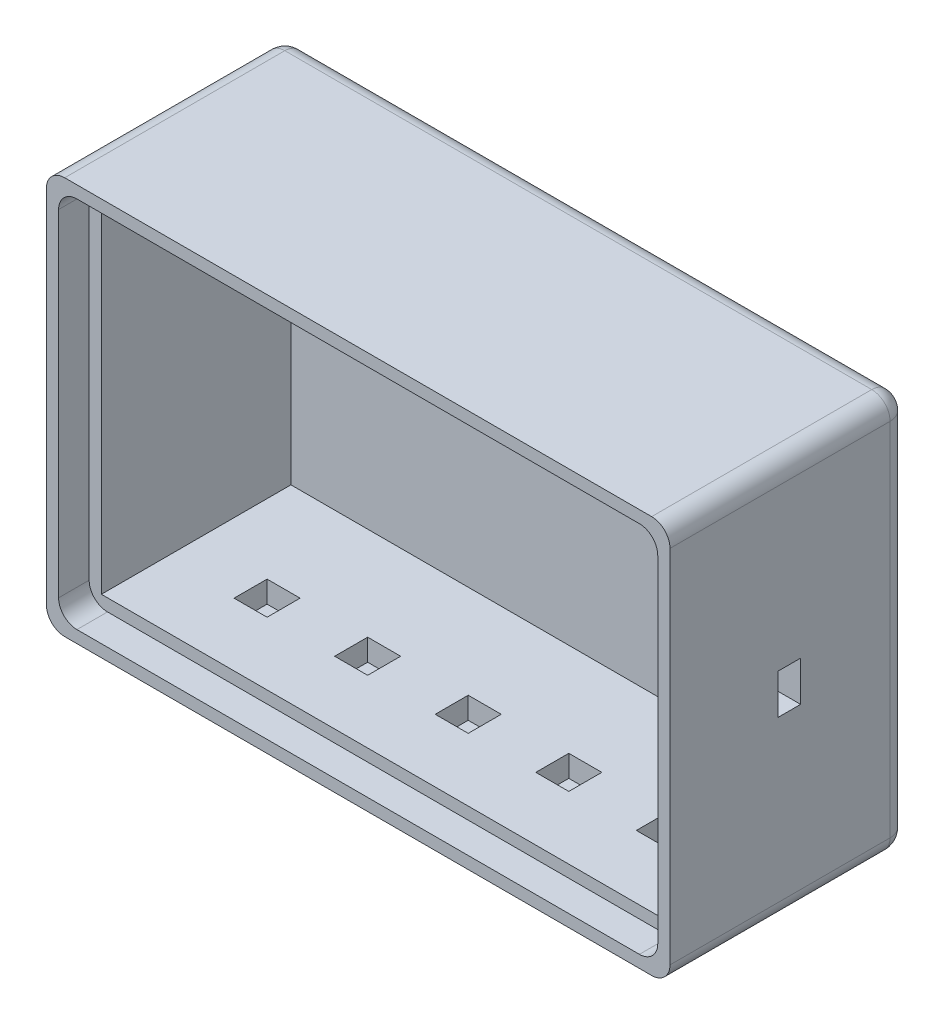
from build123d import *

# Parameters (mm, degrees)
SKICA1_W                 = 102
SKICA1_H                 = 65
P_IDAT_VYSUNUT_M1_DEPTH  = 3
SKICA1_4_W               = 102
SKICA1_4_H               = 65
SKICA1_4_W_2             = 98
SKICA1_4_H_2             = 61
P_IDAT_VYSUNUT_M2_DEPTH  = 39
SKICA1_5_W               = 98
SKICA1_5_H               = 61
SKICA1_5_W_2             = 94
SKICA1_5_H_2             = 57
P_IDAT_VYSUNUT_M3_DEPTH  = 34
SKICA2_W                 = 3.73
SKICA2_H                 = 6.55
ODEBRAT_VYSUNUT_M1_DEPTH = 4
ZAOBLIT1_R               = 3
ZAOBLIT2_R               = 3
ODEBRAT_START            = -0.45
SKICA4_W                 = 5.4
SKICA4_H                 = 5.4
ODEBRAT_VYSUNUT_M2_DEPTH = 3.55
ZAOBLIT3_R               = 3


with BuildPart() as part:
    # Skica1 → Přidat vysunutím1 (new body)
    with BuildSketch(Plane.XY):
        with Locations((49, 30.5)):
            Rectangle(SKICA1_W, SKICA1_H)
    extrude(amount=P_IDAT_VYSUNUT_M1_DEPTH)

    # Skica1<4> → Přidat vysunutím2 (add)
    with BuildSketch(Plane.XY):
        with Locations((49, 30.5)):
            Rectangle(SKICA1_4_W, SKICA1_4_H)
        with Locations((49, 30.5)):
            Rectangle(SKICA1_4_W_2, SKICA1_4_H_2, mode=Mode.SUBTRACT)
    extrude(amount=P_IDAT_VYSUNUT_M2_DEPTH)

    # Skica1<5> → Přidat vysunutím3 (add)
    with BuildSketch(Plane.XY):
        with Locations((49, 30.5)):
            Rectangle(SKICA1_5_W, SKICA1_5_H)
        with Locations((49, 30.5)):
            Rectangle(SKICA1_5_W_2, SKICA1_5_H_2, mode=Mode.SUBTRACT)
    extrude(amount=P_IDAT_VYSUNUT_M3_DEPTH)

    # Skica2 → Odebrat vysunutím1 (cut)
    with BuildSketch(Plane(origin=(100, 0, 0), x_dir=(0, 0, -1), z_dir=(1, 0, 0))):
        with Locations((-19.5, 30.5)):
            Rectangle(SKICA2_W, SKICA2_H)
    extrude(amount=-ODEBRAT_VYSUNUT_M1_DEPTH, mode=Mode.SUBTRACT)

    # Zaoblit1
    zaoblit1_edges = [part.edges().sort_by_distance(p)[0] for p in [
        (-2, 30.5, 0),
        (49, -2, 0),
        (100, 30.5, 0),
        (49, 63, 0),
    ]]
    fillet(zaoblit1_edges, radius=ZAOBLIT1_R)

    # Zaoblit2
    # the kernel refuses this fillet: 3 mm, written as the material it takes off along each edge
    with BuildSketch(Plane(origin=(97, 60, 3), x_dir=(1, 0, 0), z_dir=(0, 1, 0))) as zaoblit2_piece_1_section:
        Polygon((0, 0), (ZAOBLIT2_R, 0), (ZAOBLIT2_R, ZAOBLIT2_R), (0, ZAOBLIT2_R), align=None)
    zaoblit2_piece_1 = extrude(amount=ZAOBLIT2_R, mode=Mode.PRIVATE)
    zaoblit2_piece_1 = zaoblit2_piece_1 - Plane(origin=(97, 60, 3), x_dir=(-0.7071067811865475, 0, 0.7071067811865475), z_dir=(0, 1, 0)) * Sphere(ZAOBLIT2_R, mode=Mode.PRIVATE)
    add(zaoblit2_piece_1, mode=Mode.SUBTRACT)
    with BuildSketch(Plane(origin=(97, 1, 3), x_dir=(0, -1, 0), z_dir=(1, 0, 0))) as zaoblit2_piece_2_section:
        Polygon((0, 0), (ZAOBLIT2_R, 0), (ZAOBLIT2_R, ZAOBLIT2_R), (0, ZAOBLIT2_R), align=None)
    zaoblit2_piece_2 = extrude(amount=ZAOBLIT2_R, mode=Mode.PRIVATE)
    zaoblit2_piece_2 = zaoblit2_piece_2 - Plane(origin=(97, 1, 3), x_dir=(0, 0.7071067811865475, 0.7071067811865475), z_dir=(1, 0, 0)) * Sphere(ZAOBLIT2_R, mode=Mode.PRIVATE)
    add(zaoblit2_piece_2, mode=Mode.SUBTRACT)
    with BuildSketch(Plane(origin=(1, 60, 3), x_dir=(-1, 0, 0), z_dir=(0, 1, 0))) as zaoblit2_piece_3_section:
        Polygon((0, 0), (ZAOBLIT2_R, 0), (ZAOBLIT2_R, -ZAOBLIT2_R), (0, -ZAOBLIT2_R), align=None)
    zaoblit2_piece_3 = extrude(amount=ZAOBLIT2_R, mode=Mode.PRIVATE)
    zaoblit2_piece_3 = zaoblit2_piece_3 - Plane(origin=(1, 60, 3), x_dir=(0.7071067811865475, 0, 0.7071067811865475), z_dir=(0, 1, 0)) * Sphere(ZAOBLIT2_R, mode=Mode.PRIVATE)
    add(zaoblit2_piece_3, mode=Mode.SUBTRACT)
    with BuildSketch(Plane(origin=(1, 1, 3), x_dir=(0, -1, 0), z_dir=(-1, 0, 0))) as zaoblit2_piece_4_section:
        Polygon((0, 0), (ZAOBLIT2_R, 0), (ZAOBLIT2_R, -ZAOBLIT2_R), (0, -ZAOBLIT2_R), align=None)
    zaoblit2_piece_4 = extrude(amount=ZAOBLIT2_R, mode=Mode.PRIVATE)
    zaoblit2_piece_4 = zaoblit2_piece_4 - Plane(origin=(1, 1, 3), x_dir=(0, 0.7071067811865475, 0.7071067811865475), z_dir=(-1, 0, 0)) * Sphere(ZAOBLIT2_R, mode=Mode.PRIVATE)
    add(zaoblit2_piece_4, mode=Mode.SUBTRACT)
    with BuildSketch(Plane(origin=(-2, 63, 3), x_dir=(1, 0, 0), z_dir=(0, 0, 1)), Plane(origin=(-2, -2, 3), x_dir=(0, 1, 0), z_dir=(0, 0, 1)), Plane(origin=(100, -2, 46.5), x_dir=(0, 1, 0), z_dir=(0, 0, -1)), Plane(origin=(100, 63, 46.5), x_dir=(-1, 0, 0), z_dir=(0, 0, -1))) as zaoblit2_piece_5:
        with BuildLine():
            CenterArc((ZAOBLIT2_R, -ZAOBLIT2_R), ZAOBLIT2_R, 90, 90)
            Line((0, -ZAOBLIT2_R), (0, 0))
            Line((0, 0), (ZAOBLIT2_R, 0))
        make_face()
    extrude(amount=43.5, mode=Mode.SUBTRACT)

    # Skica4 → Odebrat vysunutím2 (cut)
    with BuildSketch(Plane.XZ.offset(2).offset(ODEBRAT_START)):
        with Locations((16.1, 21)):
            Rectangle(SKICA4_W, SKICA4_H)
        with Locations((32.55, 21)):
            Rectangle(SKICA4_W, SKICA4_H)
        with Locations((49, 21)):
            Rectangle(SKICA4_W, SKICA4_H)
        with Locations((65.45, 21)):
            Rectangle(SKICA4_W, SKICA4_H)
        with Locations((81.9, 21)):
            Rectangle(SKICA4_W, SKICA4_H)
    extrude(amount=-ODEBRAT_VYSUNUT_M2_DEPTH, mode=Mode.SUBTRACT)

    # Zaoblit3
    zaoblit3_edges = [part.edges().sort_by_distance(p)[0] for p in [
        (98, 61, 36.5),
        (98, 0, 36.5),
        (0, 0, 36.5),
        (0, 61, 36.5),
    ]]
    fillet(zaoblit3_edges, radius=ZAOBLIT3_R)


solid = part.part
